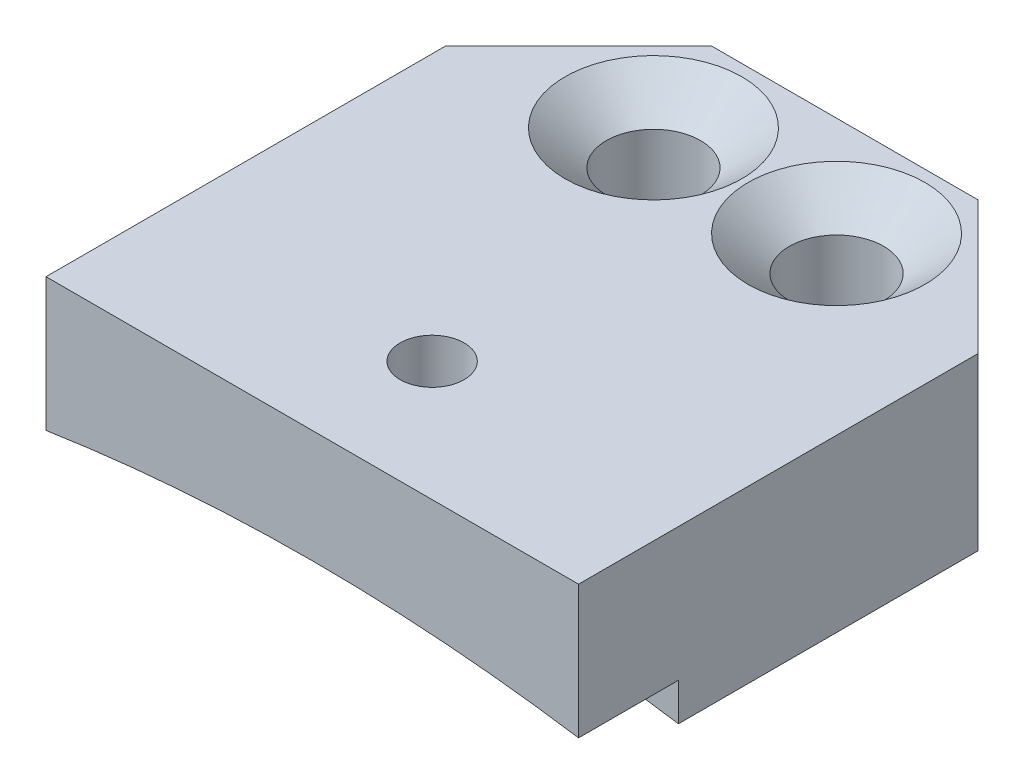
from build123d import *

# Parameters (mm, degrees)
BOSS_EXTRUDE1_DEPTH                               = 6.35
CUT_EXTRUDE1_DEPTH                                = 39.709258643
CUT_EXTRUDE1_DEPTH_BACK                           = 39.709258643
SKETCH2_R                                         = 83.82
BOSS_EXTRUDE2_DEPTH                               = 20.6375
CHAMFER1_SIZE                                     = 6.35
CSK_FOR_8_FLAT_HEAD_MACHINE_SCREW_100_D           = 4.4958
CSK_FOR_8_FLAT_HEAD_MACHINE_SCREW_100_CSINK_D     = 8.4328
CSK_FOR_8_FLAT_HEAD_MACHINE_SCREW_100_CSINK_ANGLE = 100
SKETCH6_R                                         = 1.524
CUT_EXTRUDE2_DEPTH                                = 33.316173568


with BuildPart() as part:
    # Sketch1 → Boss-Extrude1 (new body)
    with BuildSketch(Plane(origin=(0, 0, 0), x_dir=(1, 0, 0), z_dir=(0, 1, 0))):
        Polygon((-28.511825699, 6.495271113), (-22.161825699, 12.845271113), (-9.461825699, 12.845271113), (-3.111825699, 6.495271113), (-3.111825699, -12.554728887), (-28.511825699, -12.554728887), align=None)
    extrude(amount=BOSS_EXTRUDE1_DEPTH)

    # Sketch2 → Cut-Extrude1 (cut, two sides: drawn at the far end of the back side and taken through both)
    with BuildSketch(Plane.XY.offset(12.554728887).offset(-CUT_EXTRUDE1_DEPTH_BACK)):
        with Locations((-15.811825699, -82.852292666)):
            Circle(SKETCH2_R)
    extrude(amount=CUT_EXTRUDE1_DEPTH + CUT_EXTRUDE1_DEPTH_BACK, mode=Mode.SUBTRACT)

    # Sketch5 → Boss-Extrude2 (add)
    with BuildSketch(Plane(origin=(0, 0, -12.845271113), x_dir=(-1, 0, 0), z_dir=(0, 0, -1))):
        with BuildLine():
            Line((3.111825699, 6.35), (3.111825699, 0))
            Line((3.111825699, 0), (3.111825699, -1.799225087))
            ThreePointArc((3.111825699, -1.799225087), (15.811825699, -0.810292666), (28.511825699, -1.799225087))
            Line((28.511825699, -1.799225087), (28.511825699, 0))
            Line((28.511825699, 0), (28.511825699, 6.35))
            Line((28.511825699, 6.35), (3.111825699, 6.35))
        make_face()
    extrude(amount=-BOSS_EXTRUDE2_DEPTH)

    # Chamfer1
    chamfer1_edges = [part.edges().sort_by_distance(p)[0] for p in [
        (-28.511825699, 2.275387457, -12.845271113),
        (-3.111825699, 2.275387457, -12.845271113),
    ]]
    chamfer(chamfer1_edges, length=CHAMFER1_SIZE)

    # CSK for #8 Flat Head Machine Screw (100)1 (through all)
    with Locations(Plane(origin=(0, 6.35, 0), x_dir=(1, 0, 0), z_dir=(0, 1, 0))):
        with Locations((-20.177450699, 8.082771113), (-11.446200699, 8.082771113)):
            CounterSinkHole(CSK_FOR_8_FLAT_HEAD_MACHINE_SCREW_100_D / 2, CSK_FOR_8_FLAT_HEAD_MACHINE_SCREW_100_CSINK_D / 2, counter_sink_angle=CSK_FOR_8_FLAT_HEAD_MACHINE_SCREW_100_CSINK_ANGLE)

    # Sketch6 → Cut-Extrude2 (cut, through all)
    with BuildSketch(Plane(origin=(0, 6.35, 0), x_dir=(1, 0, 0), z_dir=(0, 1, 0))):
        with Locations((-15.810195404, -6.839728887)):
            Circle(SKETCH6_R)
    extrude(amount=-CUT_EXTRUDE2_DEPTH, mode=Mode.SUBTRACT)


solid = part.part
